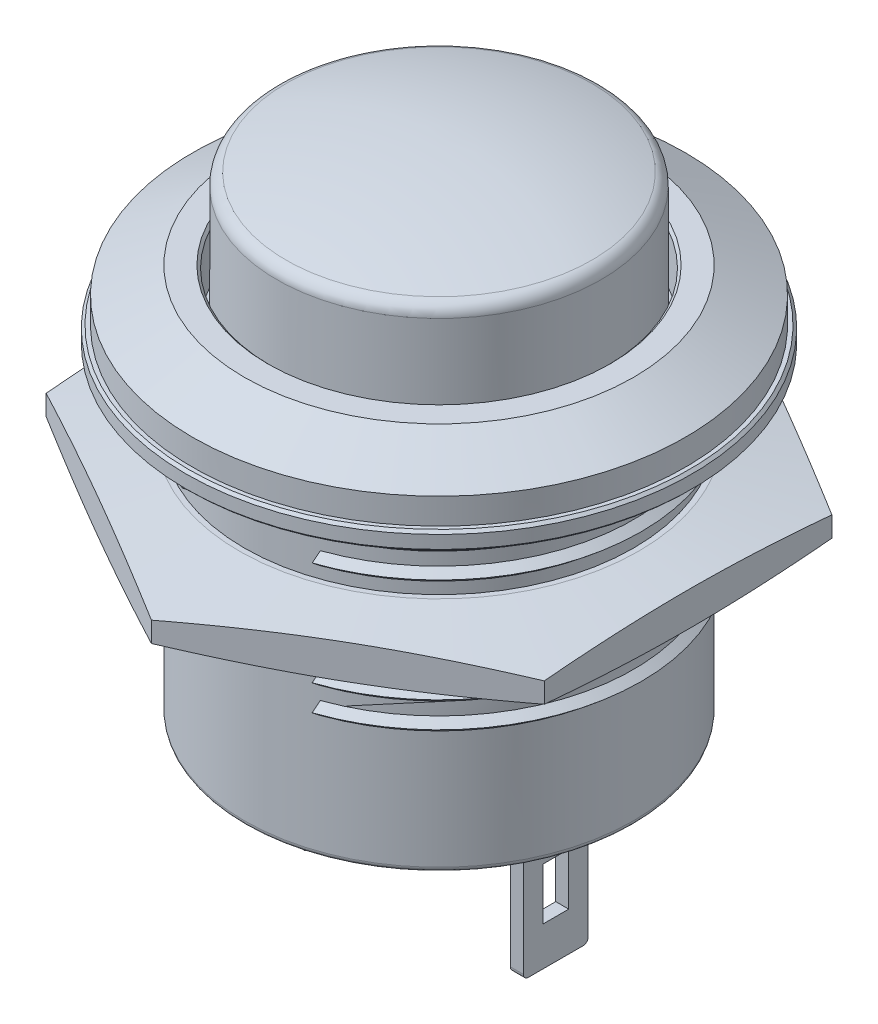
from build123d import *

# Parameters (mm, degrees)
SKETCH1_R           = 7.5
BOSS_EXTRUDE1_DEPTH = 13
SKETCH2_R           = 9.5
BOSS_EXTRUDE2_DEPTH = 2
CHAMFER1_SIZE       = 1
CHAMFER1_SIZE2      = 2
SKETCH3_R           = 6.5
CUT_EXTRUDE1_DEPTH  = 2
SKETCH4_R           = 6.25
BOSS_EXTRUDE3_DEPTH = 5
FILLET1_R           = 0.5
FILLET2_R           = 0.2
SKETCH5_R           = 7
SKETCH5_R_2         = 6.8
CUT_EXTRUDE2_DEPTH  = 1
SKETCH6_W           = 0.5
SKETCH6_H           = 5
BOSS_EXTRUDE4_DEPTH = 1
SKETCH7_W           = 0.5
SKETCH7_H           = 2.5
BOSS_EXTRUDE5_DEPTH = 5
FILLET3_R           = 0.2
SKETCH8_W           = 1
SKETCH8_H           = 2
CUT_EXTRUDE3_DEPTH  = 26.441108
SKETCH9_R           = 9.75
SKETCH9_R_2         = 7.75
BOSS_EXTRUDE6_DEPTH = 0.7
CHAMFER3_SIZE       = 0.1
LPATTERN1_COUNT     = 8
LPATTERN1_PITCH     = 1
CUT_EXTRUDE4_REACH  = 25.476
BOSS_EXTRUDE8_DEPTH = 2
BOSS_EXTRUDE9_DEPTH = 0.2


# Read off the part's stored shape, not the designer's step: Dome1
with BuildPart() as part:
    # Sketch1 → Boss-Extrude1 (new body)
    with BuildSketch(Plane(origin=(0, 0, 0), x_dir=(1, 0, 0), z_dir=(0, 1, 0))):
        with Locations(Location((0, 0, 0), (0, 0, 90))):
            Circle(SKETCH1_R)
    extrude(amount=BOSS_EXTRUDE1_DEPTH)

    # Sketch2 → Boss-Extrude2 (add)
    with BuildSketch(Plane(origin=(0, 13, 0), x_dir=(1, 0, 0), z_dir=(0, 1, 0))):
        with Locations(Location((0, 0, 0), (0, 0, 270))):
            Circle(SKETCH2_R)
    extrude(amount=BOSS_EXTRUDE2_DEPTH)

    # Chamfer1
    chamfer1_edges = [part.edges().sort_by_distance(p)[0] for p in [
        (0, 15, -9.5),
    ]]
    chamfer1_side = [part.faces().sort_by_distance(p)[0] for p in [
        (0, 14, -9.5),
    ]]
    chamfer(chamfer1_edges, length=CHAMFER1_SIZE, length2=CHAMFER1_SIZE2, reference=chamfer1_side[0])

    # Sketch3 → Cut-Extrude1 (cut)
    with BuildSketch(Plane(origin=(0, 15, 0), x_dir=(1, 0, 0), z_dir=(0, 1, 0))):
        with Locations(Location((0, 0, 0), (0, 0, 270))):
            Circle(SKETCH3_R)
    extrude(amount=-CUT_EXTRUDE1_DEPTH, mode=Mode.SUBTRACT)

    # Sketch4 → Boss-Extrude3 (add)
    with BuildSketch(Plane(origin=(0, 13, 0), x_dir=(1, 0, 0), z_dir=(0, 1, 0))):
        with Locations(Location((0, 0, 0), (0, 0, 270))):
            Circle(SKETCH4_R)
    extrude(amount=BOSS_EXTRUDE3_DEPTH)

    # Dome1 outline → Dome1 (revolve)
    with BuildSketch(Plane.XY):
        with BuildLine():
            Line((0, 18), (6.25, 18))
            ThreePointArc((6.25, 18), (3.164747, 18.74842), (0, 19))
            Line((0, 19), (0, 18))
        make_face()
    revolve(axis=Axis((0, 0, 0), (0, 1, 0)))

    # Fillet1
    fillet1_edges = [part.edges().sort_by_distance(p)[0] for p in [
        (-4.419417, 18, -4.419417),
    ]]
    fillet(fillet1_edges, radius=FILLET1_R)

    # Fillet2
    fillet2_edges = [part.edges().sort_by_distance(p)[0] for p in [
        (0, 0, 7.5),
    ]]
    fillet(fillet2_edges, radius=FILLET2_R)

    # Sketch5 → Cut-Extrude2 (cut)
    with BuildSketch(Plane.XZ):
        with Locations(Location((0, 0, 0), (0, 0, 270))):
            Circle(SKETCH5_R)
        with Locations(Location((0, 0, 0), (0, 0, 270))):
            Circle(SKETCH5_R_2, mode=Mode.SUBTRACT)
    extrude(amount=-CUT_EXTRUDE2_DEPTH, mode=Mode.SUBTRACT)

    # Sketch6 → Boss-Extrude4 (add)
    with BuildSketch(Plane.XZ):
        with Locations((-4.25, 0)):
            Rectangle(SKETCH6_W, SKETCH6_H)
        with Locations((4.25, 0)):
            Rectangle(SKETCH6_W, SKETCH6_H)
    extrude(amount=BOSS_EXTRUDE4_DEPTH)

    # Sketch7 → Boss-Extrude5 (add)
    with BuildSketch(Plane.XZ.offset(1)):
        with Locations((-4.25, 0)):
            Rectangle(SKETCH7_W, SKETCH7_H)
        with Locations((4.25, 0)):
            Rectangle(SKETCH7_W, SKETCH7_H)
    extrude(amount=BOSS_EXTRUDE5_DEPTH)

    # Fillet3
    fillet3_edges = [part.edges().sort_by_distance(p)[0] for p in [
        (4.25, -1, -2.5),
        (4.25, -1, 2.5),
        (4.25, -6, -1.25),
        (4.25, -6, 1.25),
        (-4.25, -6, 1.25),
        (-4.25, -6, -1.25),
        (-4.25, -1, -2.5),
        (-4.25, -1, 2.5),
        (4.25, -1, -1.25),
        (-4.25, -1, -1.25),
        (4.25, -1, 1.25),
        (-4.25, -1, 1.25),
    ]]
    fillet(fillet3_edges, radius=FILLET3_R)

    # Sketch8 → Cut-Extrude3 (cut, through all)
    with BuildSketch(Plane(origin=(4.5, 0, 0), x_dir=(0, 0, -1), z_dir=(1, 0, 0))):
        with Locations((0, -3.5)):
            Rectangle(SKETCH8_W, SKETCH8_H)
    extrude(amount=-CUT_EXTRUDE3_DEPTH, mode=Mode.SUBTRACT)

    # Sketch9 → Boss-Extrude6 (add)
    with BuildSketch(Plane.XZ.offset(-13)):
        with Locations(Location((0, 0, 0), (0, 0, 270))):
            Circle(SKETCH9_R)
        with Locations(Location((0, 0, 0), (0, 0, 270))):
            Circle(SKETCH9_R_2, mode=Mode.SUBTRACT)
    extrude(amount=BOSS_EXTRUDE6_DEPTH)

    # Chamfer3
    chamfer3_edges = [part.edges().sort_by_distance(p)[0] for p in [
        (0, 15, -6.5),
        (0, 12.3, 9.75),
        (0, 13, 9.75),
    ]]
    chamfer(chamfer3_edges, length=CHAMFER3_SIZE)

    # Sketch11 → Revolve1 (revolve)
    with BuildSketch(Plane.XY, mode=Mode.PRIVATE) as revolve1_sk:
        Polygon((7.5, 5.25), (7.5, 4.75), (7.8, 5), align=None)
    revolve1 = revolve(revolve1_sk.sketch.rotate(Axis((0, 0, 0), (0, 1, 0)), 90), axis=Axis((0, 0, 0), (0, 1, 0)))

    # LPattern1: Revolve1 ×8
    with Locations(*[(0, i * LPATTERN1_PITCH, 0) for i in range(1, LPATTERN1_COUNT)]):
        add(revolve1)

    # Cut-Extrude4: up to this face of the body (flat: up to its plane)
    cut_extrude4_end = Plane(part.part.faces().sort_by_distance((0, 12.3, 9.377057))[0])
    # Sketch13 → Cut-Extrude4 (cut, up to the picked face)
    with BuildSketch(Plane.XZ, mode=Mode.PRIVATE) as cut_extrude4_sk1:
        with BuildLine():
            Line((2.5, -7.071068), (2.5, -11.153203))
            Line((2.5, -11.153203), (-2.5, -11.153203))
            Line((-2.5, -11.153203), (-2.5, -7.071068))
            ThreePointArc((-2.5, -7.071068), (0, -7.5), (2.5, -7.071068))
        make_face()
    cut_extrude4_tool1 = split(extrude(cut_extrude4_sk1.sketch, amount=-CUT_EXTRUDE4_REACH, mode=Mode.PRIVATE), bisect_by=cut_extrude4_end, keep=Keep.BOTH, mode=Mode.PRIVATE)
    # Sketch13 → Cut-Extrude4 (cut, up to the picked face)
    with BuildSketch(Plane.XZ, mode=Mode.PRIVATE) as cut_extrude4_sk2:
        with BuildLine():
            Line((-2.5, 11.153203), (2.5, 11.153203))
            Line((2.5, 11.153203), (2.5, 7.071068))
            ThreePointArc((2.5, 7.071068), (0, 7.5), (-2.5, 7.071068))
            Line((-2.5, 7.071068), (-2.5, 11.153203))
        make_face()
    cut_extrude4_tool2 = split(extrude(cut_extrude4_sk2.sketch, amount=-CUT_EXTRUDE4_REACH, mode=Mode.PRIVATE), bisect_by=cut_extrude4_end, keep=Keep.BOTH, mode=Mode.PRIVATE)
    add(cut_extrude4_tool1.solids().sort_by(Axis((0, 0, -9.253815), (0, 1, 0)))[0], mode=Mode.SUBTRACT)
    add(cut_extrude4_tool2.solids().sort_by(Axis((0, 0, 9.253815), (0, 1, 0)))[0], mode=Mode.SUBTRACT)

    # Sketch10 → Boss-Extrude8 (add)
    with BuildSketch(Plane(origin=(0, 9.3, 0), x_dir=(-1, 0, 0), z_dir=(0, -1, 0))):
        Polygon((-9.6, -5.542563), (0, -11.085125), (9.6, -5.542563), (9.6, 5.542563), (0, 11.085125), (-9.6, 5.542563), align=None)
    extrude(amount=BOSS_EXTRUDE8_DEPTH)

    # Sketch14 → Cut-Revolve4 (revolve, cut)
    with BuildSketch(Plane.XY, mode=Mode.PRIVATE) as cut_revolve4_sk:
        Polygon((11.586063, 8.6), (7.7, 9.3), (11.586063, 9.3), align=None)
        Polygon((11.586063, 8), (7.7, 7.3), (11.586063, 7.3), align=None)
    revolve(cut_revolve4_sk.sketch.rotate(Axis((0, 0, 0), (0, 1, 0)), 90), axis=Axis((0, 0, 0), (0, 1, 0)), mode=Mode.SUBTRACT)

    # Sketch16 → Boss-Extrude9 (add)
    # profile 1 of 5: a face of its own
    with BuildSketch(Plane.XZ):
        Polygon((-1.916345, 4.231378), (-1.821367, 4.231378), (-1.821367, 3.828355), (-1.380182, 4.231378), (-1.244711, 4.231378), (-1.764761, 3.756485), (-1.204006, 3.173045), (-1.330573, 3.173045), (-1.821367, 3.683767), (-1.821367, 3.173045), (-1.916345, 3.173045), align=None)
    # profile 2 of 5: a face of its own
    with BuildSketch(Plane.XZ):
        with BuildLine():
            add(Edge.make_bspline(
                [(-0.552724, 4.258515), (-0.533127, 4.258019), (-0.494637, 4.257044), (-0.438069, 4.249581), (-0.384066, 4.236671), (-0.332186, 4.219477), (-0.283051, 4.19654), (-0.236291, 4.168816), (-0.192018, 4.136015), (-0.150827, 4.09839), (-0.113133, 4.057452), (-0.079924, 4.013765), (-0.052092, 3.967592), (-0.029236, 3.919072), (-0.011305, 3.868314), (0.001068, 3.815048), (0.008971, 3.75962), (0.009895, 3.721814), (0.010364, 3.702636)],
                knots=[0, 0, 0, 0, 1.065121, 2.091985, 3.094605, 4.07983, 5.057817, 6.036188, 7.030413, 8.047529, 9.0644, 10.051698, 11.02545, 11.989515, 12.962713, 13.945757, 14.957907, 16, 16, 16, 16], degree=3))
            add(Edge.make_bspline(
                [(0.010364, 3.702636), (0.009895, 3.683598), (0.008972, 3.646074), (0.001059, 3.590997), (-0.011351, 3.538053), (-0.02907, 3.48733), (-0.051816, 3.438775), (-0.079834, 3.392514), (-0.112836, 3.348534), (-0.150394, 3.307316), (-0.191336, 3.269519), (-0.235251, 3.236584), (-0.281151, 3.208243), (-0.329625, 3.18563), (-0.380032, 3.167556), (-0.432823, 3.155234), (-0.487749, 3.147285), (-0.525205, 3.146372), (-0.544243, 3.145908)],
                knots=[0, 0, 0, 0, 1.043624, 2.057104, 3.045126, 4.022048, 4.9982, 5.980619, 6.982899, 8.009068, 9.034989, 10.034168, 11.015287, 11.987932, 12.962483, 13.946735, 14.956376, 16, 16, 16, 16], degree=3))
            add(Edge.make_bspline(
                [(-0.544243, 3.145908), (-0.563422, 3.146377), (-0.601227, 3.1473), (-0.656725, 3.155217), (-0.710028, 3.167597), (-0.760984, 3.185289), (-0.80962, 3.208154), (-0.856033, 3.236035), (-0.900035, 3.269118), (-0.941262, 3.306663), (-0.978984, 3.347537), (-1.011871, 3.391332), (-1.039758, 3.437189), (-1.062546, 3.485237), (-1.080588, 3.535242), (-1.092896, 3.587539), (-1.100859, 3.641828), (-1.101777, 3.678792), (-1.102243, 3.697547)],
                knots=[0, 0, 0, 0, 1.053102, 2.075944, 3.073151, 4.055351, 5.033113, 6.020478, 7.02441, 8.052272, 9.079885, 10.075277, 11.055994, 12.023226, 12.99207, 13.970395, 14.970168, 16, 16, 16, 16], degree=3))
            add(Edge.make_bspline(
                [(-1.102243, 3.697547), (-1.102081, 3.710136), (-1.10176, 3.735155), (-1.097892, 3.772308), (-1.092279, 3.808863), (-1.084235, 3.844717), (-1.073715, 3.879781), (-1.061302, 3.914298), (-1.04614, 3.947918), (-1.029001, 3.9808), (-1.009872, 4.012431), (-0.988743, 4.042331), (-0.966356, 4.070749), (-0.941814, 4.096949), (-0.915925, 4.121694), (-0.88827, 4.144603), (-0.859017, 4.165883), (-0.82804, 4.18506), (-0.796103, 4.202405), (-0.763181, 4.217288), (-0.72972, 4.230063), (-0.695565, 4.240417), (-0.660805, 4.24859), (-0.625366, 4.254157), (-0.589274, 4.258034), (-0.56496, 4.258354), (-0.552724, 4.258515)],
                knots=[0, 0, 0, 0, 1.037016, 2.060949, 3.07488, 4.083647, 5.086023, 6.090072, 7.104154, 8.122641, 9.144369, 10.147692, 11.138137, 12.12302, 13.103399, 14.087645, 15.080126, 16.082011, 17.087798, 18.07294, 19.057185, 20.037253, 21.01196, 21.997135, 22.992091, 24, 24, 24, 24], degree=3))
        make_face()
        with BuildLine():
            add(Edge.make_bspline(
                [(-0.548059, 4.149968), (-0.558103, 4.149846), (-0.578094, 4.149602), (-0.607813, 4.146392), (-0.637142, 4.141817), (-0.666085, 4.135291), (-0.694523, 4.1264), (-0.72272, 4.116167), (-0.750419, 4.103703), (-0.777529, 4.08962), (-0.80381, 4.074032), (-0.828609, 4.056805), (-0.85199, 4.038342), (-0.873896, 4.018601), (-0.894261, 3.997479), (-0.913488, 3.975299), (-0.930805, 3.951425), (-0.946676, 3.926506), (-0.960878, 3.900573), (-0.973507, 3.8739), (-0.983838, 3.84627), (-0.992263, 3.817981), (-0.999248, 3.789078), (-1.003673, 3.759343), (-1.006918, 3.728925), (-1.007148, 3.708369), (-1.007264, 3.697972)],
                knots=[0, 0, 0, 0, 1.00856, 2.007478, 2.999611, 3.989939, 4.984837, 5.991146, 7.001802, 8.033829, 9.059044, 10.069352, 11.06506, 12.050311, 13.029377, 14.01122, 14.996726, 15.989393, 16.97758, 17.96536, 18.95171, 19.937753, 20.929683, 21.935841, 22.955955, 24, 24, 24, 24], degree=3))
            add(Edge.make_bspline(
                [(-1.007264, 3.697972), (-1.006879, 3.682682), (-1.00612, 3.652604), (-0.999481, 3.608527), (-0.989254, 3.566167), (-0.974178, 3.525756), (-0.955324, 3.486947), (-0.932033, 3.450084), (-0.904438, 3.415158), (-0.873092, 3.382411), (-0.838825, 3.352522), (-0.802439, 3.326287), (-0.764322, 3.304089), (-0.724377, 3.286005), (-0.682815, 3.271675), (-0.63937, 3.261854), (-0.59433, 3.255391), (-0.563629, 3.25477), (-0.548059, 3.254455)],
                knots=[0, 0, 0, 0, 1.032064, 2.030389, 3.003945, 3.970396, 4.937377, 5.913328, 6.909231, 7.938876, 8.970686, 9.976071, 10.964167, 11.944589, 12.933238, 13.927779, 14.94907, 16, 16, 16, 16], degree=3))
            add(Edge.make_bspline(
                [(-0.548059, 3.254455), (-0.537594, 3.254599), (-0.516838, 3.254884), (-0.485967, 3.257756), (-0.455651, 3.262362), (-0.425934, 3.268994), (-0.39685, 3.277293), (-0.368276, 3.287153), (-0.340518, 3.299454), (-0.313225, 3.313046), (-0.287101, 3.32854), (-0.262162, 3.345182), (-0.239037, 3.363618), (-0.217148, 3.383066), (-0.196699, 3.40392), (-0.177827, 3.426151), (-0.160598, 3.4499), (-0.144733, 3.474782), (-0.130581, 3.500785), (-0.11825, 3.527555), (-0.107788, 3.555025), (-0.099343, 3.583234), (-0.092726, 3.61213), (-0.088166, 3.641751), (-0.084976, 3.672037), (-0.084736, 3.692522), (-0.084615, 3.702848)],
                knots=[0, 0, 0, 0, 1.047197, 2.076907, 3.100256, 4.114472, 5.121981, 6.126383, 7.136868, 8.158578, 9.176339, 10.174871, 11.156908, 12.133735, 13.104062, 14.077631, 15.049555, 16.038496, 17.029181, 18.010276, 18.986309, 19.968651, 20.955263, 21.950658, 22.966944, 24, 24, 24, 24], degree=3))
            add(Edge.make_bspline(
                [(-0.084615, 3.702848), (-0.084736, 3.713103), (-0.084976, 3.733447), (-0.088164, 3.763522), (-0.09273, 3.792929), (-0.099311, 3.821554), (-0.107793, 3.849402), (-0.118252, 3.876449), (-0.130584, 3.902795), (-0.144738, 3.928375), (-0.160648, 3.952921), (-0.178033, 3.976386), (-0.197194, 3.998331), (-0.217582, 4.019296), (-0.239708, 4.038836), (-0.26347, 4.056955), (-0.288581, 4.074092), (-0.315168, 4.089551), (-0.342608, 4.103828), (-0.370763, 4.11606), (-0.399317, 4.126453), (-0.428196, 4.135318), (-0.457642, 4.141791), (-0.487458, 4.146396), (-0.517602, 4.149601), (-0.537875, 4.149845), (-0.548059, 4.149968)],
                knots=[0, 0, 0, 0, 1.029962, 2.043119, 3.03536, 4.018873, 4.991432, 5.957985, 6.93, 7.912077, 8.892895, 9.867086, 10.843654, 11.817741, 12.803661, 13.806313, 14.818575, 15.856121, 16.894565, 17.924821, 18.937903, 19.946497, 20.957712, 21.963978, 22.977136, 24, 24, 24, 24], degree=3))
        make_face(mode=Mode.SUBTRACT)
    # profile 3 of 5: a face of its own
    with BuildSketch(Plane.XZ):
        with BuildLine():
            Line((0.227458, 4.231378), (0.435012, 4.231378))
            add(Edge.make_bspline(
                [(0.435012, 4.231378), (0.449288, 4.231363), (0.47664, 4.231333), (0.515864, 4.230421), (0.551487, 4.229203), (0.583434, 4.227515), (0.611802, 4.225521), (0.636463, 4.222723), (0.657612, 4.219802), (0.670283, 4.216832), (0.676063, 4.215478)],
                knots=[0, 0, 0, 0, 1.415646, 2.712441, 3.890546, 4.950247, 5.884951, 6.70994, 7.411657, 8, 8, 8, 8], degree=3))
            add(Edge.make_bspline(
                [(0.676063, 4.215478), (0.683378, 4.213475), (0.697837, 4.209518), (0.718672, 4.201591), (0.738494, 4.192193), (0.757372, 4.181481), (0.775074, 4.168997), (0.791864, 4.155247), (0.807594, 4.139913), (0.822175, 4.123167), (0.835566, 4.10529), (0.847096, 4.086015), (0.85675, 4.065668), (0.86503, 4.044261), (0.870989, 4.021616), (0.875479, 3.997889), (0.878328, 3.973083), (0.878601, 3.956132), (0.87874, 3.947502)],
                knots=[0, 0, 0, 0, 0.999701, 1.975846, 2.934578, 3.890452, 4.834028, 5.787355, 6.749477, 7.72691, 8.712836, 9.690892, 10.682876, 11.67975, 12.712815, 13.76553, 14.862518, 16, 16, 16, 16], degree=3))
            add(Edge.make_bspline(
                [(0.87874, 3.947502), (0.878613, 3.938801), (0.878363, 3.921775), (0.875371, 3.896867), (0.87134, 3.873064), (0.865142, 3.850419), (0.857025, 3.829066), (0.847502, 3.808679), (0.836017, 3.789605), (0.822819, 3.771774), (0.808138, 3.755171), (0.792035, 3.739914), (0.774576, 3.726094), (0.755816, 3.713679), (0.735571, 3.702958), (0.71415, 3.693355), (0.691366, 3.68529), (0.675599, 3.681048), (0.667582, 3.678891)],
                knots=[0, 0, 0, 0, 1.121902, 2.195078, 3.232259, 4.234103, 5.217865, 6.176165, 7.13299, 8.084763, 9.034132, 9.988522, 10.942433, 11.903244, 12.886204, 13.894208, 14.929344, 16, 16, 16, 16], degree=3))
            add(Edge.make_bspline(
                [(0.667582, 3.678891), (0.660952, 3.677481), (0.646421, 3.674391), (0.62249, 3.670941), (0.594627, 3.667997), (0.56287, 3.665789), (0.527248, 3.663899), (0.487742, 3.662397), (0.444273, 3.661571), (0.413953, 3.661529), (0.398123, 3.661506)],
                knots=[0, 0, 0, 0, 0.601385, 1.31797, 2.144135, 3.087295, 4.142316, 5.309528, 6.595306, 8, 8, 8, 8], degree=3))
            Line((0.398123, 3.661506), (0.322437, 3.661506))
            Line((0.322437, 3.661506), (0.322437, 3.173045))
            Line((0.322437, 3.173045), (0.227458, 3.173045))
            Line((0.227458, 3.173045), (0.227458, 4.231378))
        make_face()
        with BuildLine():
            Line((0.322437, 4.122831), (0.322437, 3.770053))
            Line((0.322437, 3.770053), (0.50773, 3.767721))
            add(Edge.make_bspline(
                [(0.50773, 3.767721), (0.516777, 3.767717), (0.534243, 3.767708), (0.559472, 3.768913), (0.582879, 3.770304), (0.604392, 3.772341), (0.62402, 3.77522), (0.641796, 3.778126), (0.657583, 3.782331), (0.676058, 3.787992), (0.696645, 3.797648), (0.719042, 3.811664), (0.738022, 3.829528), (0.754447, 3.849615), (0.767482, 3.871961), (0.777024, 3.89587), (0.78263, 3.921097), (0.783382, 3.938359), (0.783762, 3.947078)],
                knots=[0, 0, 0, 0, 1.160614, 2.240541, 3.239931, 4.169201, 5.011653, 5.785331, 6.478054, 7.106039, 8.262395, 9.384107, 10.481366, 11.590141, 12.703576, 13.786203, 14.881775, 16, 16, 16, 16], degree=3))
            add(Edge.make_bspline(
                [(0.783762, 3.947078), (0.78338, 3.955587), (0.782621, 3.972501), (0.77698, 3.99729), (0.7675, 4.020947), (0.75436, 4.043012), (0.738412, 4.063027), (0.719876, 4.080413), (0.698796, 4.094389), (0.679187, 4.10341), (0.66177, 4.108918), (0.646641, 4.112772), (0.629559, 4.115849), (0.610519, 4.11834), (0.589668, 4.120473), (0.566826, 4.12192), (0.542082, 4.122767), (0.524903, 4.122809), (0.515998, 4.122831)],
                knots=[0, 0, 0, 0, 1.1207, 2.227813, 3.331159, 4.466774, 5.599789, 6.693662, 7.801753, 8.918577, 9.525283, 10.207425, 10.974604, 11.810963, 12.737642, 13.736265, 14.826524, 16, 16, 16, 16], degree=3))
            Line((0.515998, 4.122831), (0.322437, 4.122831))
        make_face(mode=Mode.SUBTRACT)
    # profile 4 of 5: a face of its own
    with BuildSketch(Plane.XZ):
        Polygon((1.095834, 4.231378), (1.692843, 4.231378), (1.692843, 4.122831), (1.190813, 4.122831), (1.190813, 3.79719), (1.692843, 3.79719), (1.692843, 3.688643), (1.190813, 3.688643), (1.190813, 3.281592), (1.692843, 3.281592), (1.692843, 3.173045), (1.095834, 3.173045), align=None)
    # profile 5 of 5: a face of its own
    with BuildSketch(Plane.XZ):
        Polygon((1.760685, 4.122831), (1.760685, 4.231378), (2.316988, 4.231378), (2.316988, 4.122831), (2.086326, 4.122831), (2.086326, 3.173045), (1.991347, 3.173045), (1.991347, 4.122831), align=None)
    extrude(amount=BOSS_EXTRUDE9_DEPTH)


solid = part.part
